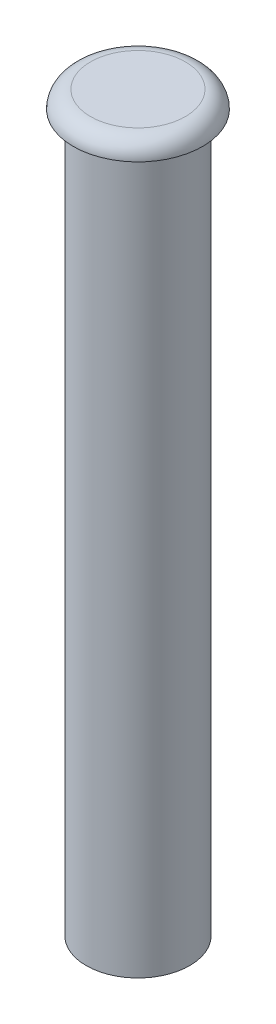
from build123d import *

# Parameters (mm, degrees)
SKETCH1_R           = 6
BOSS_EXTRUDE1_DEPTH = 83
SKETCH2_R           = 7.5
BOSS_EXTRUDE2_DEPTH = 2
FILLET1_R           = 2
SKETCH3_R           = 2
CUT_EXTRUDE1_DEPTH  = 5


with BuildPart() as part:
    # Sketch1 → Boss-Extrude1 (new body)
    with BuildSketch(Plane(origin=(0, 0, 0), x_dir=(1, 0, 0), z_dir=(0, 1, 0))):
        with Locations(Location((0, 0, 0), (0, 0, 270))):
            Circle(SKETCH1_R)
    extrude(amount=BOSS_EXTRUDE1_DEPTH)

    # Sketch2 → Boss-Extrude2 (add)
    with BuildSketch(Plane(origin=(0, 83, 0), x_dir=(1, 0, 0), z_dir=(0, 1, 0))):
        with Locations(Location((0, 0, 0), (0, 0, 270))):
            Circle(SKETCH2_R)
    extrude(amount=BOSS_EXTRUDE2_DEPTH)

    # Fillet1
    fillet1_edges = [part.edges().sort_by_distance(p)[0] for p in [
        (0, 85, -7.5),
    ]]
    fillet(fillet1_edges, radius=FILLET1_R - 0.0001)  # a hair under: the kernel refuses the full size

    # Sketch3 → Cut-Extrude1 (cut)
    with BuildSketch(Plane.XZ):
        with Locations(Location((0, 0, 0), (0, 0, 270))):
            Circle(SKETCH3_R)
    extrude(amount=-CUT_EXTRUDE1_DEPTH, mode=Mode.SUBTRACT)


solid = part.part
